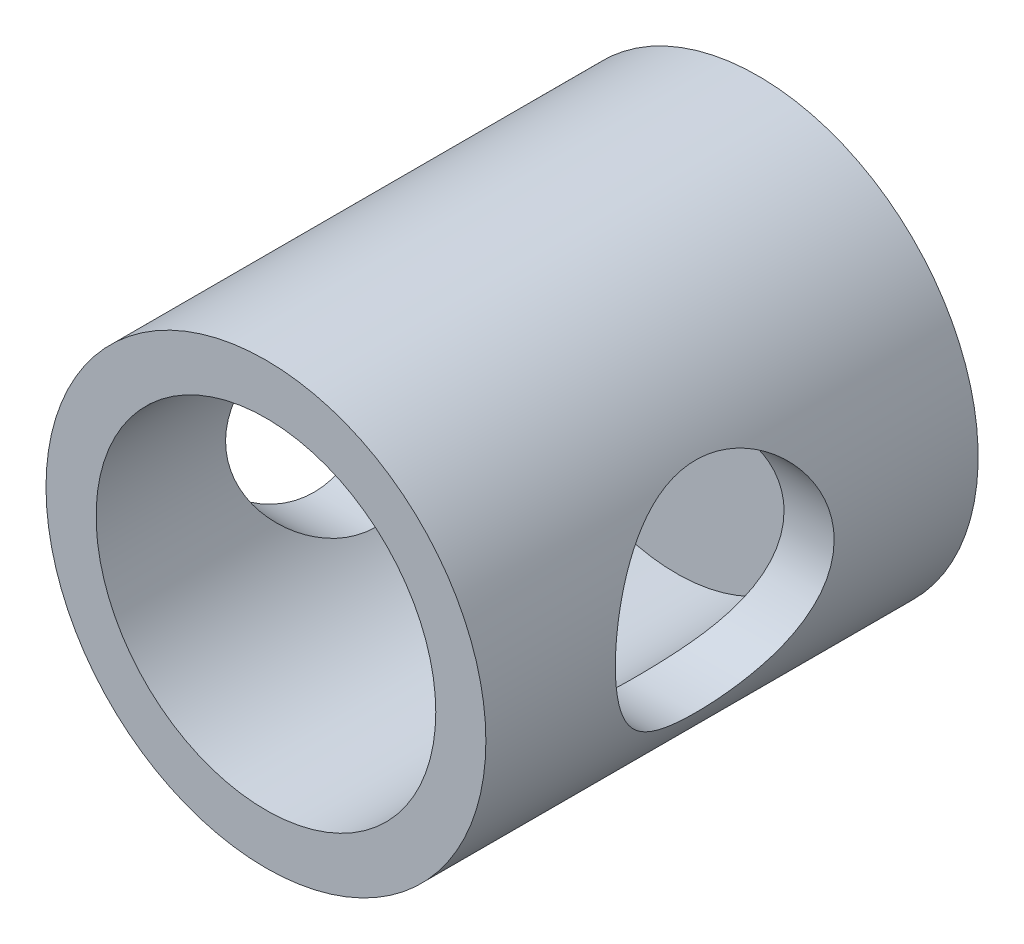
from build123d import *

# Parameters (mm, degrees)
SKETCH2_R               = 10
BOSS_EXTRUDE1_DEPTH     = 18
CUT_EXTRUDE1_DEPTH      = 18
CUT_EXTRUDE1_DEPTH_BACK = 21
SKETCH5_R               = 4
SKETCH6_OUTSIDE_W       = 28.706
SKETCH6_OUTSIDE_H       = 28.706
SKETCH6_OUTSIDE_R       = 8.042126696
CUT_EXTRUDE2_DEPTH      = 24
SKETCH8_R               = 6.210271538
CUT_EXTRUDE4_DEPTH      = 15


with BuildPart() as part:
    # Sketch2 → Boss-Extrude1 (new body)
    with BuildSketch(Plane.XY):
        Circle(SKETCH2_R)
    extrude(amount=BOSS_EXTRUDE1_DEPTH)

    # Sketch5 → Cut-Extrude1 (cut, two sides: drawn at the far end of the back side and taken through both)
    with BuildSketch(Plane(origin=(0, 0, 0), x_dir=(0, 0, -1), z_dir=(1, 0, 0)).offset(-CUT_EXTRUDE1_DEPTH_BACK)):
        with Locations((-9.266027008, 0)):
            Circle(SKETCH5_R)
    extrude(amount=CUT_EXTRUDE1_DEPTH + CUT_EXTRUDE1_DEPTH_BACK, mode=Mode.SUBTRACT)

    # Sketch6 outside → Cut-Extrude2 (cut)
    with BuildSketch(Plane(origin=(0, 0, 0), x_dir=(-1, 0, 0), z_dir=(0, 0, -1))):
        Rectangle(SKETCH6_OUTSIDE_W, SKETCH6_OUTSIDE_H)
        Circle(SKETCH6_OUTSIDE_R, mode=Mode.SUBTRACT)
    extrude(amount=-CUT_EXTRUDE2_DEPTH, mode=Mode.SUBTRACT)

    # Sketch8 → Cut-Extrude4 (cut)
    with BuildSketch(Plane.XY.offset(18)):
        Circle(SKETCH8_R)
    extrude(amount=-CUT_EXTRUDE4_DEPTH, mode=Mode.SUBTRACT)


solid = part.part
